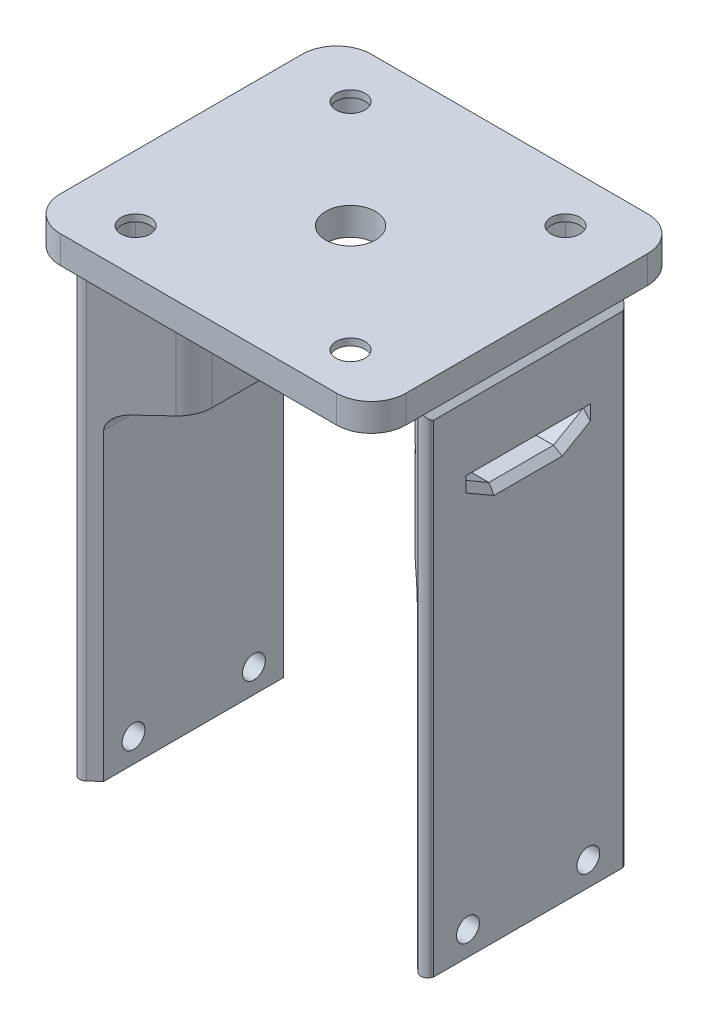
from build123d import *
from OCP.BRepFilletAPI import BRepFilletAPI_MakeChamfer

# Parameters (mm, degrees)
DODANIE_WYCI_GNI_CIE2_DEPTH = 4
WYTNIJ_WYCI_GNI_CIE3_START  = -1
WYTNIJ_WYCI_GNI_CIE3_DEPTH  = 34.205262753
SZKIC6_3_R                  = 3.6
WYTNIJ_WYCI_GNI_CIE4_DEPTH  = 35.205262753
DODANIE_WYCI_GNI_CIE3_DEPTH = 24.5
DODANIE_WYCI_GNI_CIE4_DEPTH = 46
DODANIE_WYCI_GNI_CIE5_DEPTH = 70.5
SFAZOWANIE3_SIZE            = 0.7
ZAOKR_GLENIE1_R             = 1
ZAOKR_GLENIE2_R             = 5
WYTNIJ_WYCI_GNI_CIE1_REACH  = 86.592
SZKIC3_W                    = 18
SZKIC3_H                    = 3.5
SFAZOWANIE1_SIZE            = 2.5
SFAZOWANIE1_SIZE2           = 4.330127019
ZAOKR_GLENIE4_R             = 2
SFAZOWANIE2_SIZE            = 1
ZAOKR_GLENIE3_R             = 5
SZKIC10_R                   = 2.1
WYTNIJ_WYCI_GNI_CIE5_DEPTH  = 82.189531345
SZYK_KO_OWY1_COUNT          = 4
SZKIC12_R                   = 1.65
WYTNIJ_WYCI_GNI_CIE6_DEPTH  = 91.228653985


# Read off the part's stored shape, not the designer's step: Lustro1
# Some blends are built 0.0001 mm under size
with BuildPart() as part:
    # Szkic1 → Dodanie-wyciągnięcie2 (new body)
    with BuildSketch(Plane(origin=(0, 0, 0), x_dir=(1, 0, 0), z_dir=(0, 1, 0))):
        Polygon((-25, -21), (-25, -22), (25, -22), (25, -21), (25, 23), (-25, 23), align=None)
    extrude(amount=DODANIE_WYCI_GNI_CIE2_DEPTH)

    # Szkic6 → Wytnij-wyciągnięcie3 (cut, through all)
    with BuildSketch(Plane(origin=(0, 4, 0), x_dir=(1, 0, 0), z_dir=(0, 1, 0)).offset(WYTNIJ_WYCI_GNI_CIE3_START)):
        with BuildLine():
            Line((-12.02081528, -7.778174593), (-17.67766953, -13.435028843))
            ThreePointArc((-17.67766953, -13.435028843), (-17.67766953, -17.67766953), (-13.435028843, -17.67766953))
            Line((-13.435028843, -17.67766953), (-7.778174593, -12.02081528))
            ThreePointArc((-7.778174593, -12.02081528), (-7.778174593, -7.778174593), (-12.02081528, -7.778174593))
        make_face()
        with BuildLine():
            Line((-7.778174593, 12.02081528), (-13.435028843, 17.67766953))
            ThreePointArc((-13.435028843, 17.67766953), (-17.67766953, 17.67766953), (-17.67766953, 13.435028843))
            Line((-17.67766953, 13.435028843), (-12.02081528, 7.778174593))
            ThreePointArc((-12.02081528, 7.778174593), (-7.778174593, 7.778174593), (-7.778174593, 12.02081528))
        make_face()
        with BuildLine():
            Line((12.02081528, 7.778174593), (17.67766953, 13.435028843))
            ThreePointArc((17.67766953, 13.435028843), (17.67766953, 17.67766953), (13.435028843, 17.67766953))
            Line((13.435028843, 17.67766953), (7.778174593, 12.02081528))
            ThreePointArc((7.778174593, 12.02081528), (7.778174593, 7.778174593), (12.02081528, 7.778174593))
        make_face()
        with BuildLine():
            Line((7.778174593, -12.02081528), (13.435028843, -17.67766953))
            ThreePointArc((13.435028843, -17.67766953), (17.67766953, -17.67766953), (17.67766953, -13.435028843))
            Line((17.67766953, -13.435028843), (12.02081528, -7.778174593))
            ThreePointArc((12.02081528, -7.778174593), (7.778174593, -7.778174593), (7.778174593, -12.02081528))
        make_face()
    extrude(amount=-WYTNIJ_WYCI_GNI_CIE3_DEPTH, mode=Mode.SUBTRACT)

    # Szkic6<3> → Wytnij-wyciągnięcie4 (cut, through all)
    with BuildSketch(Plane(origin=(0, 4, 0), x_dir=(1, 0, 0), z_dir=(0, 1, 0))):
        with Locations(Location((0, 0, 0), (0, 0, 270))):
            Circle(SZKIC6_3_R)
    extrude(amount=-WYTNIJ_WYCI_GNI_CIE4_DEPTH, mode=Mode.SUBTRACT)

    # Szkic2 → Dodanie-wyciągnięcie3 (add)
    with BuildSketch(Plane.XZ):
        Polygon((15.7, -6.5), (15.7, 6.5), (25, 15.172390301), (25, -15.172390301), align=None)
    extrude(amount=DODANIE_WYCI_GNI_CIE3_DEPTH)

    # Szkic8 → Dodanie-wyciągnięcie4 (add)
    with BuildSketch(Plane.XZ.offset(24.5)):
        Polygon((25, 15.172390301), (25, -15.172390301), (22.7, -13.027605603), (22.7, 13.027605603), align=None)
    extrude(amount=DODANIE_WYCI_GNI_CIE4_DEPTH)

    # Szkic11 → Dodanie-wyciągnięcie5 (add)
    with BuildSketch(Plane.XZ.offset(70.5)):
        Polygon((25, 15.172390301), (25, -15.172390301), (25.7, -13.711437924), (25.7, 13.711439266), align=None)
    extrude(amount=-DODANIE_WYCI_GNI_CIE5_DEPTH)

    # Sfazowanie3
    sfazowanie3_edges = [part.edges().sort_by_distance(p)[0] for p in [
        (25.7, 0, 6.71e-07),
    ]]
    chamfer(sfazowanie3_edges, length=SFAZOWANIE3_SIZE - 0.0001)  # a hair under: the kernel refuses the full size

    # Zaokrąglenie1
    # the kernel refuses this fillet: 1 mm, written as the material it takes off along each edge
    with BuildSketch(Plane(origin=(25, 0, 15.172390301), x_dir=(0.4321005826211705, 0, -0.9018254190797934), z_dir=(0, -1, 0))) as zaokr_glenie1_piece_1:
        with BuildLine():
            CenterArc((ZAOKR_GLENIE1_R * 1.36131157072, -ZAOKR_GLENIE1_R), ZAOKR_GLENIE1_R, 90, 107.399057565)
            Line((ZAOKR_GLENIE1_R * 0.407066323534, -ZAOKR_GLENIE1_R * 1.2990250963), (0, 0))
            Line((0, 0), (ZAOKR_GLENIE1_R * 1.36131157072, 0))
        make_face()
    extrude(amount=73.903278927, mode=Mode.SUBTRACT)
    with BuildSketch(Plane(origin=(25, -73.903280204, -15.172390301), x_dir=(0.43210025968346966, 0, 0.901825573812075), z_dir=(0, 1, 0))) as zaokr_glenie1_piece_2:
        with BuildLine():
            CenterArc((ZAOKR_GLENIE1_R * 1.36131208157, -ZAOKR_GLENIE1_R), ZAOKR_GLENIE1_R, 90, 107.399078082)
            Line((ZAOKR_GLENIE1_R * 0.407066941463, -ZAOKR_GLENIE1_R * 1.29902543801), (0, 0))
            Line((0, 0), (ZAOKR_GLENIE1_R * 1.36131208157, 0))
        make_face()
    extrude(amount=73.903280204, mode=Mode.SUBTRACT)

    # Zaokrąglenie2
    zaokr_glenie2_edges = [part.edges().sort_by_distance(p)[0] for p in [
        (15.7, -12.25, 6.5),
        (15.7, -12.25, -6.5),
    ]]
    fillet(zaokr_glenie2_edges, radius=ZAOKR_GLENIE2_R)

    # Szkic3 → Wytnij-wyciągnięcie1 (cut, up to next)
    with BuildSketch(Plane.ZY.offset(-15.7), mode=Mode.PRIVATE) as wytnij_wyci_gni_cie1_sk1:
        with Locations((0, -11.75)):
            Rectangle(SZKIC3_W, SZKIC3_H)
    wytnij_wyci_gni_cie1_tool1 = extrude(wytnij_wyci_gni_cie1_sk1.sketch, amount=-WYTNIJ_WYCI_GNI_CIE1_REACH, mode=Mode.PRIVATE) & part.part
    add(wytnij_wyci_gni_cie1_tool1.solids().sort_by_distance((15.7, -11.75, 0))[0], mode=Mode.SUBTRACT)

    # Sfazowanie1: one chamfer whose edges measure the first distance from different faces: ONE call of the kernel's chamfer builder (chamfer() names one face for all edges)
    sfazowanie1_edges_1 = [part.edges().sort_by_distance(p)[0] for p in [
        (22.040460888, -13.5, -9),
    ]]
    sfazowanie1_side_1 = [part.faces().sort_by_distance(p)[0] for p in [
        (22.040460888, -11.75, -9),
    ]]
    sfazowanie1_edges_2 = [part.edges().sort_by_distance(p)[0] for p in [
        (22.040460888, -13.5, 9),
    ]]
    sfazowanie1_side_2 = [part.faces().sort_by_distance(p)[0] for p in [
        (22.040460888, -11.75, 9),
    ]]
    sfazowanie1 = BRepFilletAPI_MakeChamfer(part.part.solid().wrapped)
    for e in sfazowanie1_edges_1:
        sfazowanie1.Add(SFAZOWANIE1_SIZE, SFAZOWANIE1_SIZE2, e.wrapped, sfazowanie1_side_1[0].wrapped)  # the first distance lies on this face
    for e in sfazowanie1_edges_2:
        sfazowanie1.Add(SFAZOWANIE1_SIZE, SFAZOWANIE1_SIZE2, e.wrapped, sfazowanie1_side_2[0].wrapped)  # the first distance lies on this face
    add(Compound.cast(sfazowanie1.Shape()), mode=Mode.REPLACE)

    # Zaokrąglenie4
    zaokr_glenie4_edges = [part.edges().sort_by_distance(p)[0] for p in [
        (22.7, -24.5, 0),
    ]]
    fillet(zaokr_glenie4_edges, radius=ZAOKR_GLENIE4_R)

    # Lustro1: part across plane


with BuildPart() as part_1:
    add(part.part)
    add(part.part.mirror(Plane(origin=(0, 0, 0), x_dir=(0, 0, 1), z_dir=(1, 0, 0))))

    # Sfazowanie2
    sfazowanie2_edges = [part_1.edges().sort_by_distance(p)[0] for p in [
        (25.7, -13.5, 0),
        (25.7, -12.25, -6.834936491),
        (25.7, -12.25, 6.834936491),
        (-25.7, -13.5, 0),
        (-25.7, -12.25, -6.834936491),
        (-25.7, -12.25, 6.834936491),
    ]]
    chamfer(sfazowanie2_edges, length=SFAZOWANIE2_SIZE)

    # Zaokrąglenie3
    zaokr_glenie3_edges = [part_1.edges().sort_by_distance(p)[0] for p in [
        (25, 2, 22),
        (-25, 2, 22),
        (-25, 2, -23),
        (25, 2, -23),
    ]]
    fillet(zaokr_glenie3_edges, radius=ZAOKR_GLENIE3_R)

    # Szkic10 → Wytnij-wyciągnięcie5 (cut, through all)
    with BuildSketch(Plane.XZ.offset(-3)):
        with Locations(Location((-15.556349186, 15.556349186, 0), (0, 0, 270))):
            Circle(SZKIC10_R)
    wytnij_wyci_gni_cie5 = extrude(amount=-WYTNIJ_WYCI_GNI_CIE5_DEPTH, mode=Mode.SUBTRACT)

    # Szyk kołowy1: Wytnij-wyciągnięcie5 ×4 about axis
    szyk_ko_owy1_axis = Axis((0, 0, 0), (0, 1, 0))
    for i in range(1, SZYK_KO_OWY1_COUNT):
        add(wytnij_wyci_gni_cie5.rotate(szyk_ko_owy1_axis, i * 360 / SZYK_KO_OWY1_COUNT), mode=Mode.SUBTRACT)

    # Szkic12 → Wytnij-wyciągnięcie6 (cut, through all)
    with BuildSketch(Plane.ZY.offset(25.7)):
        with Locations((8.711439266, -67)):
            Circle(SZKIC12_R)
        with Locations(Location((-8.711439266, -67, 0), (0, 0, 180))):
            Circle(SZKIC12_R)
    extrude(amount=-WYTNIJ_WYCI_GNI_CIE6_DEPTH, mode=Mode.SUBTRACT)


solid = part_1.part
